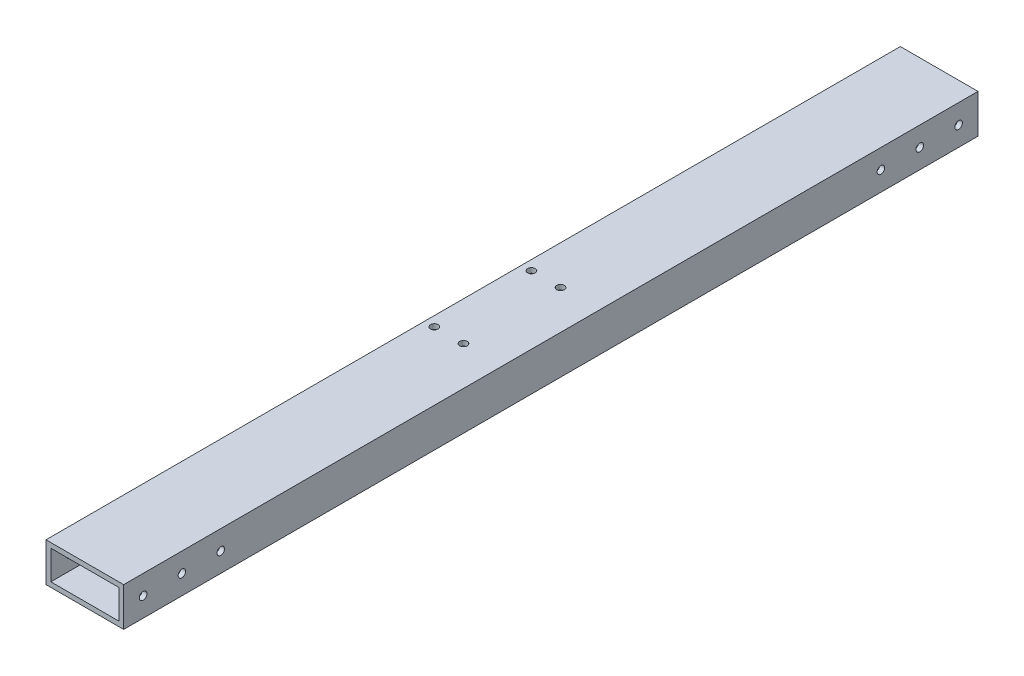
from build123d import *

# Parameters (mm, degrees)
SKETCH1_W               = 50.8
SKETCH1_H               = 25.4
BOSS_EXTRUDE1_DEPTH     = 279.4
SHELL1_T                = -3.175
CUT_EXTRUDE1_DEPTH      = 281.839473721
CUT_EXTRUDE1_DEPTH_BACK = 281.839473721
SKETCH3_R               = 2.4892
CUT_EXTRUDE2_DEPTH      = 281.839473721
CUT_EXTRUDE2_DEPTH_BACK = 281.839473721
SKETCH4_R               = 2.4892


with BuildPart() as part:
    # Sketch1 → Boss-Extrude1 (new, symmetric)
    with BuildSketch(Plane.XY):
        Rectangle(SKETCH1_W, SKETCH1_H)
    extrude(amount=BOSS_EXTRUDE1_DEPTH, both=True)

    # Shell1
    shell1_openings = [part.faces().sort_by_distance(p)[0] for p in [
        (0, 0, -279.4),
        (0, 0, 279.4),
    ]]
    offset(amount=SHELL1_T, openings=shell1_openings, kind=Kind.INTERSECTION)

    # Sketch3 → Cut-Extrude1 (cut, two sides: drawn at the far end of the back side and taken through both)
    with BuildSketch(Plane(origin=(0, 0, 0), x_dir=(0, 0, -1), z_dir=(1, 0, 0)).offset(-CUT_EXTRUDE1_DEPTH_BACK)):
        with Locations((-266.7, 0)):
            Circle(SKETCH3_R)
        with Locations((-241.3, 0)):
            Circle(SKETCH3_R)
        with Locations((-215.9, 0)):
            Circle(SKETCH3_R)
        with Locations((215.9, 0)):
            Circle(SKETCH3_R)
        with Locations((241.3, 0)):
            Circle(SKETCH3_R)
        with Locations((266.7, 0)):
            Circle(SKETCH3_R)
    extrude(amount=CUT_EXTRUDE1_DEPTH + CUT_EXTRUDE1_DEPTH_BACK, mode=Mode.SUBTRACT)

    # Sketch4 → Cut-Extrude2 (cut, two sides: drawn at the far end of the back side and taken through both)
    with BuildSketch(Plane(origin=(0, 0, 0), x_dir=(1, 0, 0), z_dir=(0, 1, 0)).offset(-CUT_EXTRUDE2_DEPTH_BACK)):
        with Locations((0, -31.75)):
            Circle(SKETCH4_R)
        with Locations((-19.05, -31.75)):
            Circle(SKETCH4_R)
        with Locations((0, 31.75)):
            Circle(SKETCH4_R)
        with Locations((-19.05, 31.75)):
            Circle(SKETCH4_R)
    extrude(amount=CUT_EXTRUDE2_DEPTH + CUT_EXTRUDE2_DEPTH_BACK, mode=Mode.SUBTRACT)


solid = part.part
